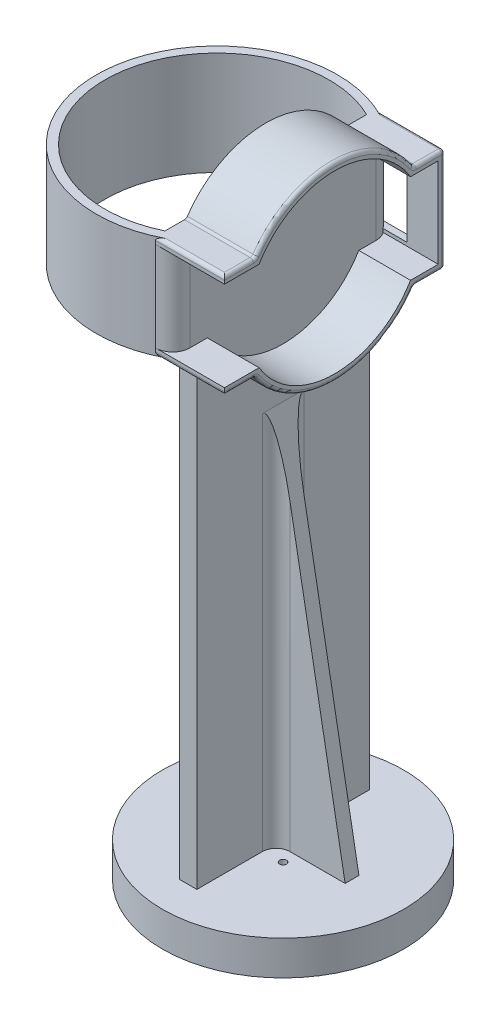
from build123d import *

# Parameters (mm, degrees)
CROQUIS1_R                   = 35
SALIENTE_EXTRUIR1_DEPTH      = 10
CROQUIS4_W                   = 50
CROQUIS4_H                   = 150
SALIENTE_EXTRUIR3_DEPTH      = 5
SALIENTE_EXTRUIR4_DEPTH      = 15
SALIENTE_EXTRUIR4_DEPTH_BACK = 5
CORTAR_EXTRUIR2_DEPTH        = 15
SALIENTE_EXTRUIR5_DEPTH      = 30
CORTAR_EXTRUIR3_REACH        = 208.35
CROQUIS7_W                   = 6
CROQUIS7_H                   = 24
REDONDEO1_R                  = 5
REDONDEO2_R                  = 1
NERVIO1_REACH                = 200.284
CROQUIS8_WALL_W              = 510.370900346
CROQUIS8_WALL_H              = 4
CROQUIS11_R                  = 1
CORTAR_EXTRUIR7_DEPTH        = 10
CROQUIS13_R                  = 3
CORTAR_EXTRUIR8_DEPTH        = 3
CROQUIS14_R                  = 11.5
CORTAR_EXTRUIR9_DEPTH        = 2
REDONDEO3_R                  = 4


# Some blends are built 0.0001 mm under size
with BuildPart() as part:
    # Croquis1 → Saliente-Extruir1 (new body)
    with BuildSketch(Plane(origin=(0, 0, 0), x_dir=(1, 0, 0), z_dir=(0, 1, 0))):
        with Locations(Location((0, 0, 0), (0, 0, 270))):
            Circle(CROQUIS1_R)
    extrude(amount=SALIENTE_EXTRUIR1_DEPTH)

    # Croquis4 → Saliente-Extruir3 (add)
    with BuildSketch(Plane(origin=(0, 0, 0), x_dir=(0, 0, -1), z_dir=(1, 0, 0))):
        with Locations((0, 85)):
            Rectangle(CROQUIS4_W, CROQUIS4_H)
    extrude(amount=-SALIENTE_EXTRUIR3_DEPTH)

    # Croquis5 → Saliente-Extruir4 (add, two sides: drawn at the far end of the back side and taken through both)
    with BuildSketch(Plane(origin=(0, 0, 0), x_dir=(0, 0, -1), z_dir=(1, 0, 0)).offset(-SALIENTE_EXTRUIR4_DEPTH_BACK)):
        with BuildLine():
            Line((32, 175), (23.048861143, 175))
            ThreePointArc((23.048861143, 175), (26.363741023, 167.823244805), (27.5, 160))
            ThreePointArc((27.5, 160), (26.867731575, 154.1369803), (25, 148.543560763))
            Line((25, 148.543560763), (25, 145))
            Line((25, 145), (32, 145))
            Line((32, 145), (32, 175))
        make_face()
        with BuildLine():
            ThreePointArc((27.5, 160), (26.363741023, 167.823244805), (23.048861143, 175))
            Line((23.048861143, 175), (23, 175))
            Line((23, 175), (23, 160))
            Line((23, 160), (25, 160))
            Line((25, 160), (25, 148.543560763))
            ThreePointArc((25, 148.543560763), (26.867731575, 154.1369803), (27.5, 160))
        make_face()
        with BuildLine():
            Line((23, 145), (23.048861143, 145))
            ThreePointArc((23.048861143, 145), (24.08967559, 146.735855475), (25, 148.543560763))
            Line((25, 148.543560763), (25, 160))
            Line((25, 160), (23, 160))
            Line((23, 160), (23, 145))
        make_face()
        with BuildLine():
            Line((-23, 145), (-23.048861143, 145))
            ThreePointArc((-23.048861143, 145), (0, 132.5), (23.048861143, 145))
            Line((23.048861143, 145), (23, 145))
            Line((23, 145), (23, 160))
            Line((23, 160), (-23, 160))
            Line((-23, 160), (-23, 145))
        make_face()
        with BuildLine():
            ThreePointArc((23.048861143, 175), (0, 187.5), (-23.048861143, 175))
            Line((-23.048861143, 175), (-23, 175))
            Line((-23, 175), (-23, 160))
            Line((-23, 160), (23, 160))
            Line((23, 160), (23, 175))
            Line((23, 175), (23.048861143, 175))
        make_face()
        with BuildLine():
            ThreePointArc((-23.048861143, 175), (-27.425518383, 162.022607582), (-25, 148.543560763))
            Line((-25, 148.543560763), (-25, 160))
            Line((-25, 160), (-23, 160))
            Line((-23, 160), (-23, 175))
            Line((-23, 175), (-23.048861143, 175))
        make_face()
        with BuildLine():
            ThreePointArc((-25, 148.543560763), (-24.08967559, 146.735855475), (-23.048861143, 145))
            Line((-23.048861143, 145), (-23, 145))
            Line((-23, 145), (-23, 160))
            Line((-23, 160), (-25, 160))
            Line((-25, 160), (-25, 148.543560763))
        make_face()
        with BuildLine():
            Line((-32, 175), (-32, 145))
            Line((-32, 145), (-25, 145))
            Line((-25, 145), (-25, 148.543560763))
            ThreePointArc((-25, 148.543560763), (-27.425518383, 162.022607582), (-23.048861143, 175))
            Line((-23.048861143, 175), (-32, 175))
        make_face()
        with BuildLine():
            Line((-25, 148.543560763), (-25, 145))
            Line((-25, 145), (-23.048861143, 145))
            ThreePointArc((-23.048861143, 145), (-24.08967559, 146.735855475), (-25, 148.543560763))
        make_face()
        with BuildLine():
            ThreePointArc((25, 148.543560763), (24.08967559, 146.735855475), (23.048861143, 145))
            Line((23.048861143, 145), (25, 145))
            Line((25, 145), (25, 148.543560763))
        make_face()
    extrude(amount=SALIENTE_EXTRUIR4_DEPTH + SALIENTE_EXTRUIR4_DEPTH_BACK)

    # Croquis3D1 → Cortar-Extruir2 (cut)
    with BuildSketch(Plane(origin=(15, 173, 21.964208854), x_dir=(0, -0.44745996476077016, -0.8943039639497805), z_dir=(-1, 0, 0))):
        with BuildLine():
            Line((0, 0), (-7.186439875, 3.595694823))
            Line((-7.186439875, 3.595694823), (-8.975047803, 4.490614752))
            Line((-8.975047803, 4.490614752), (2.658911281, 27.742517815))
            Line((2.658911281, 27.742517815), (4.447519209, 26.847597886))
            Line((4.447519209, 26.847597886), (11.633959084, 23.251903063))
            add(Edge.make_bspline(
                [(11.633959084, 23.251903063), (11.821134587, 23.361557768), (12.008310091, 23.471212473), (12.195485595, 23.580867178), (12.639027512, 23.840711321), (13.082569429, 24.100555463), (13.340059825, 24.248743681), (14.119274903, 24.681301019), (14.928837491, 25.059825437), (15.478894065, 25.291716547), (16.87205695, 25.829188383), (18.290650957, 26.283246181), (19.150643623, 26.522226893), (20.887663596, 26.926430552), (22.657477082, 27.16941903), (23.547807499, 27.251155178), (25.333766272, 27.336202706), (27.119222103, 27.266583515), (28.009685995, 27.193092604), (29.78180916, 26.968718879), (31.527769934, 26.589502806), (32.39196977, 26.361819705), (34.09832844, 25.831574416), (35.751645293, 25.154113043), (36.56297625, 24.779518686), (38.150849198, 23.96048333), (39.660876152, 23.005516089), (40.394575881, 22.495359566), (41.81564334, 21.41232085), (43.1366378, 20.209071064), (43.770414953, 19.578984629), (44.981125449, 18.265071124), (46.071341018, 16.850041251), (46.585330652, 16.119171551), (47.549084787, 14.614571283), (48.380410984, 13.031946598), (48.760811382, 12.222973127), (49.373475059, 10.74966355), (49.859865002, 9.231774538), (50.051481317, 8.55647962), (50.32117475, 7.483239769), (50.544879698, 6.399614661), (50.618582194, 6.002126595), (50.699128791, 5.497846956), (50.760655408, 4.99122444), (50.772955822, 4.885315185), (50.809442312, 4.563825108), (50.845928803, 4.242335031), (50.870391592, 4.026788295), (50.894854381, 3.811241559), (50.91931717, 3.595694823)],
                knots=[0, 0, 0, 0, 0, 0, 0.02054517, 0.02054517, 0.02054517, 0.048685024, 0.048685024, 0.048685024, 0.104964733, 0.104964733, 0.104964733, 0.189384297, 0.189384297, 0.189384297, 0.273803861, 0.273803861, 0.273803861, 0.358223425, 0.358223425, 0.358223425, 0.442642989, 0.442642989, 0.442642989, 0.527062553, 0.527062553, 0.527062553, 0.611482116, 0.611482116, 0.611482116, 0.69590168, 0.69590168, 0.69590168, 0.780321244, 0.780321244, 0.780321244, 0.864740808, 0.864740808, 0.864740808, 0.93111867, 0.93111867, 0.93111867, 0.969356677, 0.969356677, 0.969356677, 0.97945483, 0.97945483, 0.97945483, 1, 1, 1, 1, 1, 1], degree=5))
            Line((50.91931717, 3.595694823), (58.105757046, 0))
            Line((58.105757046, 0), (46.471797962, -23.251903063))
            Line((46.471797962, -23.251903063), (39.285358087, -19.65620824))
            add(Edge.make_bspline(
                [(39.285358087, -19.65620824), (39.098182583, -19.765862945), (38.911007079, -19.87551765), (38.723831576, -19.985172356), (38.280289658, -20.245016498), (37.836747741, -20.50486064), (37.579257346, -20.653048858), (36.800042268, -21.085606196), (35.990479679, -21.464130614), (35.440423106, -21.696021724), (34.047260221, -22.23349356), (32.628666214, -22.687551358), (31.768673547, -22.92653207), (30.031653574, -23.330735729), (28.261840088, -23.573724207), (27.371509671, -23.655460355), (25.585550898, -23.740507883), (23.800095068, -23.670888692), (22.909631175, -23.597397781), (21.13750801, -23.373024056), (19.391547237, -22.993807983), (18.5273474, -22.766124882), (16.82098873, -22.235879593), (15.167671878, -21.55841822), (14.35634092, -21.183823863), (12.768467973, -20.364788507), (11.258441018, -19.409821266), (10.524741289, -18.899664743), (9.103673831, -17.816626027), (7.782679371, -16.613376241), (7.148902218, -15.983289806), (5.938191721, -14.669376301), (4.847976153, -13.254346428), (4.333986518, -12.523476728), (3.370232383, -11.01887646), (2.538906187, -9.436251775), (2.158505788, -8.627278304), (1.545842111, -7.153968727), (1.059452168, -5.636079715), (0.867835854, -4.960784797), (0.598142421, -3.887544946), (0.374437473, -2.803919838), (0.300734976, -2.406431772), (0.220188379, -1.902152133), (0.158661762, -1.395529617), (0.146361349, -1.289620362), (0.109874858, -0.968130285), (0.073388367, -0.646640209), (0.048925578, -0.431093472), (0.024462789, -0.215546736), (0, 0)],
                knots=[0, 0, 0, 0, 0, 0, 0.02054517, 0.02054517, 0.02054517, 0.048685024, 0.048685024, 0.048685024, 0.104964733, 0.104964733, 0.104964733, 0.189384297, 0.189384297, 0.189384297, 0.273803861, 0.273803861, 0.273803861, 0.358223425, 0.358223425, 0.358223425, 0.442642989, 0.442642989, 0.442642989, 0.527062553, 0.527062553, 0.527062553, 0.611482116, 0.611482116, 0.611482116, 0.69590168, 0.69590168, 0.69590168, 0.780321244, 0.780321244, 0.780321244, 0.864740808, 0.864740808, 0.864740808, 0.93111867, 0.93111867, 0.93111867, 0.969356677, 0.969356677, 0.969356677, 0.97945483, 0.97945483, 0.97945483, 1, 1, 1, 1, 1, 1], degree=5))
        make_face()
    extrude(amount=CORTAR_EXTRUIR2_DEPTH, mode=Mode.SUBTRACT)

    # Croquis6 → Saliente-Extruir5 (add)
    with BuildSketch(Plane.XZ.offset(-145)):
        with BuildLine():
            Line((-5, 32), (-5, 29.244657632))
            ThreePointArc((-5, 29.244657632), (-51.677446879, 0), (-5, -29.244657632))
            Line((-5, -29.244657632), (-5, -32))
            ThreePointArc((-5, -32), (-54.177446879, 0), (-5, 32))
        make_face()
    extrude(amount=-SALIENTE_EXTRUIR5_DEPTH)

    # Croquis7 → Cortar-Extruir3 (cut, up to next)
    with BuildSketch(Plane(origin=(0, 0, -32), x_dir=(-1, 0, 0), z_dir=(0, 0, -1)), mode=Mode.PRIVATE) as cortar_extruir3_sk1:
        with Locations((-3, 160)):
            Rectangle(CROQUIS7_W, CROQUIS7_H)
    cortar_extruir3_tool1 = extrude(cortar_extruir3_sk1.sketch, amount=-CORTAR_EXTRUIR3_REACH, mode=Mode.PRIVATE) & part.part
    add(cortar_extruir3_tool1.solids().sort_by_distance((3, 160, -32))[0], mode=Mode.SUBTRACT)

    # Redondeo1
    redondeo1_edges = [part.edges().sort_by_distance(p)[0] for p in [
        (0, 160, -32),
        (0, 160, 32),
    ]]
    fillet(redondeo1_edges, radius=REDONDEO1_R - 0.0001)  # a hair under: the kernel refuses the full size

    # Redondeo2
    redondeo2_edges = [part.edges().sort_by_distance(p)[0] for p in [
        (7.5, 145, -23.048861143),
        (7.5, 145, 23.048861143),
        (5, 175, 23.048861143),
        (5, 175, -23.048861143),
        (5, 175, -32),
        (5, 145, -32),
        (15, 175, -27.524430572),
        (15, 145, -27.524430572),
        (15, 132.5, 0),
        (5, 145, 32),
        (15, 145, 27.524430572),
        (15, 175, 27.524430572),
        (15, 187.5, 0),
        (5, 175, 32),
        (15, 160, -32),
    ]]
    fillet(redondeo2_edges, radius=REDONDEO2_R)

    # Croquis8 wall → Nervio1 (add, up to next)
    with BuildSketch(Plane(origin=(10, 65, 0), x_dir=(0.1788854382, -0.9838699101, 0), z_dir=(0.9838699101, 0.1788854382, 0)), mode=Mode.PRIVATE) as nervio1_sk1:
        Rectangle(CROQUIS8_WALL_W, CROQUIS8_WALL_H)
    nervio1_tool1 = extrude(nervio1_sk1.sketch, amount=-NERVIO1_REACH, mode=Mode.PRIVATE) - part.part
    nervio1 = nervio1_tool1.solids().sort_by_distance((10, 65, 0))[0]
    add(nervio1)

    # Croquis11 → Cortar-Extruir7 (cut)
    with BuildSketch(Plane.XZ):
        with Locations(Location((5.656854249, 5.656854249, 0), (0, 0, 270))):
            Circle(CROQUIS11_R)
        with Locations(Location((5.656854249, -5.656854249, 0), (0, 0, 270))):
            Circle(CROQUIS11_R)
        with Locations(Location((-5.656854249, -5.656854249, 0), (0, 0, 270))):
            Circle(CROQUIS11_R)
        with Locations(Location((-5.656854249, 5.656854249, 0), (0, 0, 270))):
            Circle(CROQUIS11_R)
    extrude(amount=-CORTAR_EXTRUIR7_DEPTH, mode=Mode.SUBTRACT)

    # Croquis13 → Cortar-Extruir8 (cut)
    with BuildSketch(Plane(origin=(0, 10, 0), x_dir=(1, 0, 0), z_dir=(0, 1, 0))):
        with Locations((-5.656854249, 5.656854249)):
            Circle(CROQUIS13_R)
        with Locations((-5.656854249, -5.656854249)):
            Circle(CROQUIS13_R)
    extrude(amount=CORTAR_EXTRUIR8_DEPTH, mode=Mode.SUBTRACT)

    # Croquis14 → Cortar-Extruir9 (cut)
    with BuildSketch(Plane.XZ):
        with Locations(Location((0, 0, 0), (0, 0, 270))):
            Circle(CROQUIS14_R)
    extrude(amount=-CORTAR_EXTRUIR9_DEPTH, mode=Mode.SUBTRACT)

    # Simetría1: Nervio1 across plane
    add(nervio1.mirror(Plane.ZY.offset(2.5)))

    # Redondeo3
    # the kernel refuses this fillet: 4 mm, written as the material it adds along each edge
    with BuildSketch(Plane(origin=(-5, 130, -2), x_dir=(0, 0, -1), z_dir=(0, -1, 0))) as redondeo3_piece_1_section:
        with BuildLine():
            CenterArc((REDONDEO3_R, -REDONDEO3_R), REDONDEO3_R, 90, 90)
            Line((0, -REDONDEO3_R), (0, 0))
            Line((0, 0), (REDONDEO3_R, 0))
        make_face()
    redondeo3_piece_1 = extrude(amount=130, mode=Mode.PRIVATE)
    redondeo3_piece_1 = split(redondeo3_piece_1, bisect_by=Plane(origin=(-5.057051212, 13, -5.123027705), z_dir=(0, 1, 0)), keep=Keep.TOP, mode=Mode.PRIVATE)
    redondeo3_piece_1 = split(redondeo3_piece_1, bisect_by=Plane(origin=(-14.445438426, 68.050088656, -5.123027705), z_dir=(0.9838699100999074, -0.1788854381999832, 0)), keep=Keep.TOP, mode=Mode.PRIVATE)
    add(redondeo3_piece_1)
    with BuildSketch(Plane(origin=(-5, 130, -2), x_dir=(0, 0, -1), z_dir=(0, -1, 0))) as redondeo3_piece_2_section:
        with BuildLine():
            CenterArc((REDONDEO3_R, -REDONDEO3_R), REDONDEO3_R, 90, 90)
            Line((0, -REDONDEO3_R), (0, 0))
            Line((0, 0), (REDONDEO3_R, 0))
        make_face()
    redondeo3_piece_2 = extrude(amount=130, mode=Mode.PRIVATE)
    redondeo3_piece_2 = redondeo3_piece_2 - Plane(origin=(-5.656854249, 11.5, -5.656854249), x_dir=(1, 0, 0), z_dir=(0, -1, 0)) * Cylinder(3, 277, mode=Mode.PRIVATE)
    redondeo3_piece_2 = split(redondeo3_piece_2, bisect_by=Plane(origin=(-24.137648659, 14.742932375, -2.308845146), z_dir=(0.9838699100999074, -0.1788854381999832, 0)), keep=Keep.TOP, mode=Mode.PRIVATE)
    redondeo3_piece_2 = split(redondeo3_piece_2, bisect_by=Plane(origin=(-6.301520596, 2, -2.308845146), z_dir=(0, 1, 0)), keep=Keep.TOP, mode=Mode.PRIVATE)
    add(redondeo3_piece_2)
    with BuildSketch(Plane(origin=(0, 130, -2), x_dir=(0, 0, -1), z_dir=(0, -1, 0))) as redondeo3_piece_3_section:
        with BuildLine():
            CenterArc((REDONDEO3_R, REDONDEO3_R), REDONDEO3_R, 180, 90)
            Line((0, REDONDEO3_R), (0, 0))
            Line((0, 0), (REDONDEO3_R, 0))
        make_face()
    redondeo3_piece_3 = extrude(amount=130, mode=Mode.PRIVATE)
    redondeo3_piece_3 = split(redondeo3_piece_3, bisect_by=Plane(origin=(10.125839236, 64.3078842, -2.910792171), z_dir=(-0.9838699100999074, -0.17888543819998318, 0)), keep=Keep.TOP, mode=Mode.PRIVATE)
    redondeo3_piece_3 = split(redondeo3_piece_3, bisect_by=Plane(origin=(0.864029528, 2, -2.910792171), z_dir=(0, 1, 0)), keep=Keep.TOP, mode=Mode.PRIVATE)
    add(redondeo3_piece_3)
    with BuildSketch(Plane(origin=(-5, 0, 2), x_dir=(0, 0, 1), z_dir=(0, 1, 0))) as redondeo3_piece_4_section:
        with BuildLine():
            CenterArc((REDONDEO3_R, -REDONDEO3_R), REDONDEO3_R, 90, 90)
            Line((0, -REDONDEO3_R), (0, 0))
            Line((0, 0), (REDONDEO3_R, 0))
        make_face()
    redondeo3_piece_4 = extrude(amount=130, mode=Mode.PRIVATE)
    redondeo3_piece_4 = split(redondeo3_piece_4, bisect_by=Plane(origin=(-14.445438426, 68.050088659, 5.123027705), z_dir=(0.9838699100999074, -0.1788854381999832, 0)), keep=Keep.TOP, mode=Mode.PRIVATE)
    redondeo3_piece_4 = split(redondeo3_piece_4, bisect_by=Plane(origin=(-5.057051212, 13, 5.123027705), z_dir=(0, 1, 0)), keep=Keep.TOP, mode=Mode.PRIVATE)
    add(redondeo3_piece_4)
    with BuildSketch(Plane(origin=(-5, 0, 2), x_dir=(0, 0, 1), z_dir=(0, 1, 0))) as redondeo3_piece_5_section:
        with BuildLine():
            CenterArc((REDONDEO3_R, -REDONDEO3_R), REDONDEO3_R, 90, 90)
            Line((0, -REDONDEO3_R), (0, 0))
            Line((0, 0), (REDONDEO3_R, 0))
        make_face()
    redondeo3_piece_5 = extrude(amount=130, mode=Mode.PRIVATE)
    redondeo3_piece_5 = redondeo3_piece_5 - Plane(origin=(-5.656854249, 11.5, 5.656854249), x_dir=(1, 0, 0), z_dir=(0, -1, 0)) * Cylinder(3, 277, mode=Mode.PRIVATE)
    redondeo3_piece_5 = split(redondeo3_piece_5, bisect_by=Plane(origin=(-6.301520596, 13, 2.308845146), z_dir=(0, -1, 0)), keep=Keep.TOP, mode=Mode.PRIVATE)
    redondeo3_piece_5 = split(redondeo3_piece_5, bisect_by=Plane(origin=(-6.301520596, 2, 2.308845146), z_dir=(0, 1, 0)), keep=Keep.TOP, mode=Mode.PRIVATE)
    add(redondeo3_piece_5)
    with BuildSketch(Plane(origin=(0, 0, 2), x_dir=(0, 0, 1), z_dir=(0, 1, 0))) as redondeo3_piece_6_section:
        with BuildLine():
            CenterArc((REDONDEO3_R, REDONDEO3_R), REDONDEO3_R, 180, 90)
            Line((0, REDONDEO3_R), (0, 0))
            Line((0, 0), (REDONDEO3_R, 0))
        make_face()
    redondeo3_piece_6 = extrude(amount=130, mode=Mode.PRIVATE)
    redondeo3_piece_6 = split(redondeo3_piece_6, bisect_by=Plane(origin=(10.125839236, 64.3078842, 2.910792171), z_dir=(-0.9838699100999074, -0.17888543819998318, 0)), keep=Keep.TOP, mode=Mode.PRIVATE)
    redondeo3_piece_6 = split(redondeo3_piece_6, bisect_by=Plane(origin=(0.864029528, 2, 2.910792171), z_dir=(0, 1, 0)), keep=Keep.TOP, mode=Mode.PRIVATE)
    add(redondeo3_piece_6)


solid = part.part
